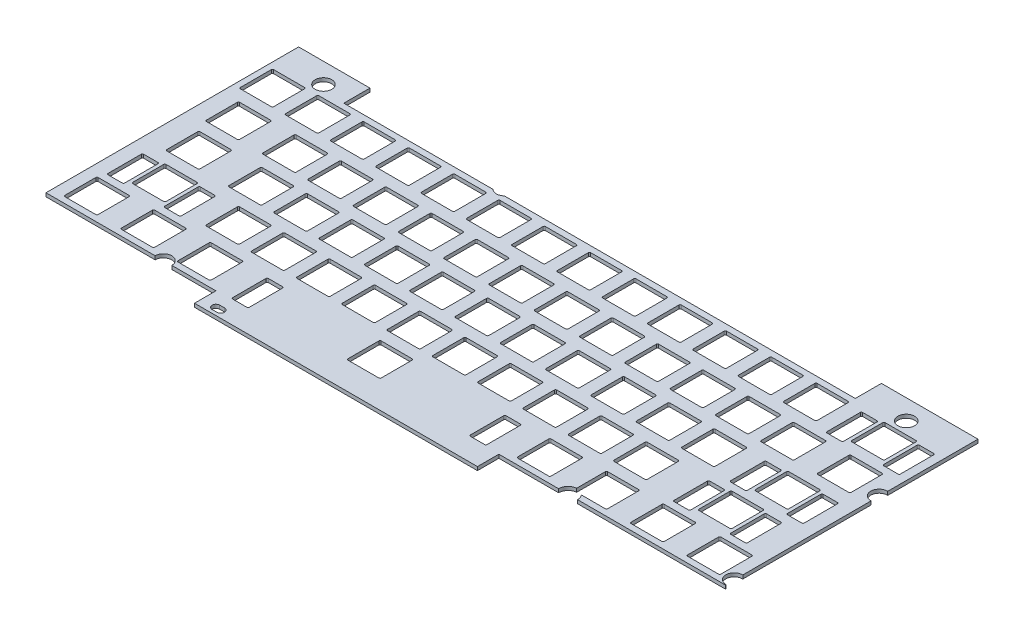
from build123d import *
from build123d.topology import SkipClean

# Parameters (mm, degrees)
SKETCH_3_W          = 285.75
SKETCH_3_H          = 95.25
EXTRUDE_2_DEPTH     = 1.5
CUT_EXTRUDE_1_REACH = 303.211
SKETCH_4_R          = 3.5
SKETCH_4_R_2        = 4
SKETCH_5_W          = 119
SKETCH_5_H          = 9
EXTRUDE_3_DEPTH     = 1.5
CUT_EXTRUDE_2_DEPTH = 1.5


with BuildPart() as part:
    # 草图3 → 凸台-拉伸2 (new body)
    with BuildSketch(Plane(origin=(0, 0, 0), x_dir=(1, 0, 0), z_dir=(0, 1, 0))):
        with Locations((142.875, -47.625)):
            Rectangle(SKETCH_3_W, SKETCH_3_H)
        with BuildLine():
            Line((3.025, -2.525), (16.025, -2.525))
            ThreePointArc((16.025, -2.525), (16.378553391, -2.671446609), (16.525, -3.025))
            Line((16.525, -3.025), (16.525, -16.025))
            ThreePointArc((16.525, -16.025), (16.378553391, -16.378553391), (16.025, -16.525))
            Line((16.025, -16.525), (3.025, -16.525))
            ThreePointArc((3.025, -16.525), (2.671446609, -16.378553391), (2.525, -16.025))
            Line((2.525, -16.025), (2.525, -3.025))
            ThreePointArc((2.525, -3.025), (2.671446609, -2.671446609), (3.025, -2.525))
        make_face(mode=Mode.SUBTRACT)
        with BuildLine():
            Line((22.075, -2.525), (35.075, -2.525))
            ThreePointArc((35.075, -2.525), (35.428553391, -2.671446609), (35.575, -3.025))
            Line((35.575, -3.025), (35.575, -16.025))
            ThreePointArc((35.575, -16.025), (35.428553391, -16.378553391), (35.075, -16.525))
            Line((35.075, -16.525), (22.075, -16.525))
            ThreePointArc((22.075, -16.525), (21.721446609, -16.378553391), (21.575, -16.025))
            Line((21.575, -16.025), (21.575, -3.025))
            ThreePointArc((21.575, -3.025), (21.721446609, -2.671446609), (22.075, -2.525))
        make_face(mode=Mode.SUBTRACT)
        with BuildLine():
            Line((41.125, -2.525), (54.125, -2.525))
            ThreePointArc((54.125, -2.525), (54.478553391, -2.671446609), (54.625, -3.025))
            Line((54.625, -3.025), (54.625, -16.025))
            ThreePointArc((54.625, -16.025), (54.478553391, -16.378553391), (54.125, -16.525))
            Line((54.125, -16.525), (41.125, -16.525))
            ThreePointArc((41.125, -16.525), (40.771446609, -16.378553391), (40.625, -16.025))
            Line((40.625, -16.025), (40.625, -3.025))
            ThreePointArc((40.625, -3.025), (40.771446609, -2.671446609), (41.125, -2.525))
        make_face(mode=Mode.SUBTRACT)
        with BuildLine():
            Line((60.175, -2.525), (73.175, -2.525))
            ThreePointArc((73.175, -2.525), (73.528553391, -2.671446609), (73.675, -3.025))
            Line((73.675, -3.025), (73.675, -16.025))
            ThreePointArc((73.675, -16.025), (73.528553391, -16.378553391), (73.175, -16.525))
            Line((73.175, -16.525), (60.175, -16.525))
            ThreePointArc((60.175, -16.525), (59.821446609, -16.378553391), (59.675, -16.025))
            Line((59.675, -16.025), (59.675, -3.025))
            ThreePointArc((59.675, -3.025), (59.821446609, -2.671446609), (60.175, -2.525))
        make_face(mode=Mode.SUBTRACT)
        with BuildLine():
            Line((79.225, -2.525), (92.225, -2.525))
            ThreePointArc((92.225, -2.525), (92.578553391, -2.671446609), (92.725, -3.025))
            Line((92.725, -3.025), (92.725, -16.025))
            ThreePointArc((92.725, -16.025), (92.578553391, -16.378553391), (92.225, -16.525))
            Line((92.225, -16.525), (79.225, -16.525))
            ThreePointArc((79.225, -16.525), (78.871446609, -16.378553391), (78.725, -16.025))
            Line((78.725, -16.025), (78.725, -3.025))
            ThreePointArc((78.725, -3.025), (78.871446609, -2.671446609), (79.225, -2.525))
        make_face(mode=Mode.SUBTRACT)
        with BuildLine():
            Line((98.275, -2.525), (111.275, -2.525))
            ThreePointArc((111.275, -2.525), (111.628553391, -2.671446609), (111.775, -3.025))
            Line((111.775, -3.025), (111.775, -16.025))
            ThreePointArc((111.775, -16.025), (111.628553391, -16.378553391), (111.275, -16.525))
            Line((111.275, -16.525), (98.275, -16.525))
            ThreePointArc((98.275, -16.525), (97.921446609, -16.378553391), (97.775, -16.025))
            Line((97.775, -16.025), (97.775, -3.025))
            ThreePointArc((97.775, -3.025), (97.921446609, -2.671446609), (98.275, -2.525))
        make_face(mode=Mode.SUBTRACT)
        with BuildLine():
            Line((117.325, -2.525), (130.325, -2.525))
            ThreePointArc((130.325, -2.525), (130.678553391, -2.671446609), (130.825, -3.025))
            Line((130.825, -3.025), (130.825, -16.025))
            ThreePointArc((130.825, -16.025), (130.678553391, -16.378553391), (130.325, -16.525))
            Line((130.325, -16.525), (117.325, -16.525))
            ThreePointArc((117.325, -16.525), (116.971446609, -16.378553391), (116.825, -16.025))
            Line((116.825, -16.025), (116.825, -3.025))
            ThreePointArc((116.825, -3.025), (116.971446609, -2.671446609), (117.325, -2.525))
        make_face(mode=Mode.SUBTRACT)
        with BuildLine():
            Line((136.375, -2.525), (149.375, -2.525))
            ThreePointArc((149.375, -2.525), (149.728553391, -2.671446609), (149.875, -3.025))
            Line((149.875, -3.025), (149.875, -16.025))
            ThreePointArc((149.875, -16.025), (149.728553391, -16.378553391), (149.375, -16.525))
            Line((149.375, -16.525), (136.375, -16.525))
            ThreePointArc((136.375, -16.525), (136.021446609, -16.378553391), (135.875, -16.025))
            Line((135.875, -16.025), (135.875, -3.025))
            ThreePointArc((135.875, -3.025), (136.021446609, -2.671446609), (136.375, -2.525))
        make_face(mode=Mode.SUBTRACT)
        with BuildLine():
            Line((155.425, -2.525), (168.425, -2.525))
            ThreePointArc((168.425, -2.525), (168.778553391, -2.671446609), (168.925, -3.025))
            Line((168.925, -3.025), (168.925, -16.025))
            ThreePointArc((168.925, -16.025), (168.778553391, -16.378553391), (168.425, -16.525))
            Line((168.425, -16.525), (155.425, -16.525))
            ThreePointArc((155.425, -16.525), (155.071446609, -16.378553391), (154.925, -16.025))
            Line((154.925, -16.025), (154.925, -3.025))
            ThreePointArc((154.925, -3.025), (155.071446609, -2.671446609), (155.425, -2.525))
        make_face(mode=Mode.SUBTRACT)
        with BuildLine():
            Line((174.475, -2.525), (187.475, -2.525))
            ThreePointArc((187.475, -2.525), (187.828553391, -2.671446609), (187.975, -3.025))
            Line((187.975, -3.025), (187.975, -16.025))
            ThreePointArc((187.975, -16.025), (187.828553391, -16.378553391), (187.475, -16.525))
            Line((187.475, -16.525), (174.475, -16.525))
            ThreePointArc((174.475, -16.525), (174.121446609, -16.378553391), (173.975, -16.025))
            Line((173.975, -16.025), (173.975, -3.025))
            ThreePointArc((173.975, -3.025), (174.121446609, -2.671446609), (174.475, -2.525))
        make_face(mode=Mode.SUBTRACT)
        with BuildLine():
            Line((193.525, -2.525), (206.525, -2.525))
            ThreePointArc((206.525, -2.525), (206.878553391, -2.671446609), (207.025, -3.025))
            Line((207.025, -3.025), (207.025, -16.025))
            ThreePointArc((207.025, -16.025), (206.878553391, -16.378553391), (206.525, -16.525))
            Line((206.525, -16.525), (193.525, -16.525))
            ThreePointArc((193.525, -16.525), (193.171446609, -16.378553391), (193.025, -16.025))
            Line((193.025, -16.025), (193.025, -3.025))
            ThreePointArc((193.025, -3.025), (193.171446609, -2.671446609), (193.525, -2.525))
        make_face(mode=Mode.SUBTRACT)
        with BuildLine():
            Line((212.575, -2.525), (225.575, -2.525))
            ThreePointArc((225.575, -2.525), (225.928553391, -2.671446609), (226.075, -3.025))
            Line((226.075, -3.025), (226.075, -16.025))
            ThreePointArc((226.075, -16.025), (225.928553391, -16.378553391), (225.575, -16.525))
            Line((225.575, -16.525), (212.575, -16.525))
            ThreePointArc((212.575, -16.525), (212.221446609, -16.378553391), (212.075, -16.025))
            Line((212.075, -16.025), (212.075, -3.025))
            ThreePointArc((212.075, -3.025), (212.221446609, -2.671446609), (212.575, -2.525))
        make_face(mode=Mode.SUBTRACT)
        with BuildLine():
            Line((231.625, -2.525), (244.625, -2.525))
            ThreePointArc((244.625, -2.525), (244.978553391, -2.671446609), (245.125, -3.025))
            Line((245.125, -3.025), (245.125, -16.025))
            ThreePointArc((245.125, -16.025), (244.978553391, -16.378553391), (244.625, -16.525))
            Line((244.625, -16.525), (231.625, -16.525))
            ThreePointArc((231.625, -16.525), (231.271446609, -16.378553391), (231.125, -16.025))
            Line((231.125, -16.025), (231.125, -3.025))
            ThreePointArc((231.125, -3.025), (231.271446609, -2.671446609), (231.625, -2.525))
        make_face(mode=Mode.SUBTRACT)
        with BuildLine():
            Line((260.2, -2.525), (273.2, -2.525))
            ThreePointArc((273.2, -2.525), (273.553553391, -2.671446609), (273.7, -3.025))
            Line((273.7, -3.025), (273.7, -16.025))
            ThreePointArc((273.7, -16.025), (273.553553391, -16.378553391), (273.2, -16.525))
            Line((273.2, -16.525), (260.2, -16.525))
            ThreePointArc((260.2, -16.525), (259.846446609, -16.378553391), (259.7, -16.025))
            Line((259.7, -16.025), (259.7, -3.025))
            ThreePointArc((259.7, -3.025), (259.846446609, -2.671446609), (260.2, -2.525))
        make_face(mode=Mode.SUBTRACT)
        with BuildLine():
            Line((251.762, -3.525), (257.762, -3.525))
            ThreePointArc((257.762, -3.525), (258.115553391, -3.671446609), (258.262, -4.025))
            Line((258.262, -4.025), (258.262, -18.025))
            ThreePointArc((258.262, -18.025), (258.115553391, -18.378553391), (257.762, -18.525))
            Line((257.762, -18.525), (251.762, -18.525))
            ThreePointArc((251.762, -18.525), (251.408446609, -18.378553391), (251.262, -18.025))
            Line((251.262, -18.025), (251.262, -4.025))
            ThreePointArc((251.262, -4.025), (251.408446609, -3.671446609), (251.762, -3.525))
        make_face(mode=Mode.SUBTRACT)
        with BuildLine():
            Line((275.638, -3.525), (281.638, -3.525))
            ThreePointArc((281.638, -3.525), (281.991553391, -3.671446609), (282.138, -4.025))
            Line((282.138, -4.025), (282.138, -18.025))
            ThreePointArc((282.138, -18.025), (281.991553391, -18.378553391), (281.638, -18.525))
            Line((281.638, -18.525), (275.638, -18.525))
            ThreePointArc((275.638, -18.525), (275.284446609, -18.378553391), (275.138, -18.025))
            Line((275.138, -18.025), (275.138, -4.025))
            ThreePointArc((275.138, -4.025), (275.284446609, -3.671446609), (275.638, -3.525))
        make_face(mode=Mode.SUBTRACT)
        with BuildLine():
            Line((7.7875, -21.575), (20.7875, -21.575))
            ThreePointArc((20.7875, -21.575), (21.141053391, -21.721446609), (21.2875, -22.075))
            Line((21.2875, -22.075), (21.2875, -35.075))
            ThreePointArc((21.2875, -35.075), (21.141053391, -35.428553391), (20.7875, -35.575))
            Line((20.7875, -35.575), (7.7875, -35.575))
            ThreePointArc((7.7875, -35.575), (7.433946609, -35.428553391), (7.2875, -35.075))
            Line((7.2875, -35.075), (7.2875, -22.075))
            ThreePointArc((7.2875, -22.075), (7.433946609, -21.721446609), (7.7875, -21.575))
        make_face(mode=Mode.SUBTRACT)
        with BuildLine():
            Line((31.6, -21.575), (44.6, -21.575))
            ThreePointArc((44.6, -21.575), (44.953553391, -21.721446609), (45.1, -22.075))
            Line((45.1, -22.075), (45.1, -35.075))
            ThreePointArc((45.1, -35.075), (44.953553391, -35.428553391), (44.6, -35.575))
            Line((44.6, -35.575), (31.6, -35.575))
            ThreePointArc((31.6, -35.575), (31.246446609, -35.428553391), (31.1, -35.075))
            Line((31.1, -35.075), (31.1, -22.075))
            ThreePointArc((31.1, -22.075), (31.246446609, -21.721446609), (31.6, -21.575))
        make_face(mode=Mode.SUBTRACT)
        with BuildLine():
            Line((50.65, -21.575), (63.65, -21.575))
            ThreePointArc((63.65, -21.575), (64.003553391, -21.721446609), (64.15, -22.075))
            Line((64.15, -22.075), (64.15, -35.075))
            ThreePointArc((64.15, -35.075), (64.003553391, -35.428553391), (63.65, -35.575))
            Line((63.65, -35.575), (50.65, -35.575))
            ThreePointArc((50.65, -35.575), (50.296446609, -35.428553391), (50.15, -35.075))
            Line((50.15, -35.075), (50.15, -22.075))
            ThreePointArc((50.15, -22.075), (50.296446609, -21.721446609), (50.65, -21.575))
        make_face(mode=Mode.SUBTRACT)
        with BuildLine():
            Line((69.7, -21.575), (82.7, -21.575))
            ThreePointArc((82.7, -21.575), (83.053553391, -21.721446609), (83.2, -22.075))
            Line((83.2, -22.075), (83.2, -35.075))
            ThreePointArc((83.2, -35.075), (83.053553391, -35.428553391), (82.7, -35.575))
            Line((82.7, -35.575), (69.7, -35.575))
            ThreePointArc((69.7, -35.575), (69.346446609, -35.428553391), (69.2, -35.075))
            Line((69.2, -35.075), (69.2, -22.075))
            ThreePointArc((69.2, -22.075), (69.346446609, -21.721446609), (69.7, -21.575))
        make_face(mode=Mode.SUBTRACT)
        with BuildLine():
            Line((88.75, -21.575), (101.75, -21.575))
            ThreePointArc((101.75, -21.575), (102.103553391, -21.721446609), (102.25, -22.075))
            Line((102.25, -22.075), (102.25, -35.075))
            ThreePointArc((102.25, -35.075), (102.103553391, -35.428553391), (101.75, -35.575))
            Line((101.75, -35.575), (88.75, -35.575))
            ThreePointArc((88.75, -35.575), (88.396446609, -35.428553391), (88.25, -35.075))
            Line((88.25, -35.075), (88.25, -22.075))
            ThreePointArc((88.25, -22.075), (88.396446609, -21.721446609), (88.75, -21.575))
        make_face(mode=Mode.SUBTRACT)
        with BuildLine():
            Line((107.8, -21.575), (120.8, -21.575))
            ThreePointArc((120.8, -21.575), (121.153553391, -21.721446609), (121.3, -22.075))
            Line((121.3, -22.075), (121.3, -35.075))
            ThreePointArc((121.3, -35.075), (121.153553391, -35.428553391), (120.8, -35.575))
            Line((120.8, -35.575), (107.8, -35.575))
            ThreePointArc((107.8, -35.575), (107.446446609, -35.428553391), (107.3, -35.075))
            Line((107.3, -35.075), (107.3, -22.075))
            ThreePointArc((107.3, -22.075), (107.446446609, -21.721446609), (107.8, -21.575))
        make_face(mode=Mode.SUBTRACT)
        with BuildLine():
            Line((126.85, -21.575), (139.85, -21.575))
            ThreePointArc((139.85, -21.575), (140.203553391, -21.721446609), (140.35, -22.075))
            Line((140.35, -22.075), (140.35, -35.075))
            ThreePointArc((140.35, -35.075), (140.203553391, -35.428553391), (139.85, -35.575))
            Line((139.85, -35.575), (126.85, -35.575))
            ThreePointArc((126.85, -35.575), (126.496446609, -35.428553391), (126.35, -35.075))
            Line((126.35, -35.075), (126.35, -22.075))
            ThreePointArc((126.35, -22.075), (126.496446609, -21.721446609), (126.85, -21.575))
        make_face(mode=Mode.SUBTRACT)
        with BuildLine():
            Line((145.9, -21.575), (158.9, -21.575))
            ThreePointArc((158.9, -21.575), (159.253553391, -21.721446609), (159.4, -22.075))
            Line((159.4, -22.075), (159.4, -35.075))
            ThreePointArc((159.4, -35.075), (159.253553391, -35.428553391), (158.9, -35.575))
            Line((158.9, -35.575), (145.9, -35.575))
            ThreePointArc((145.9, -35.575), (145.546446609, -35.428553391), (145.4, -35.075))
            Line((145.4, -35.075), (145.4, -22.075))
            ThreePointArc((145.4, -22.075), (145.546446609, -21.721446609), (145.9, -21.575))
        make_face(mode=Mode.SUBTRACT)
        with BuildLine():
            Line((164.95, -21.575), (177.95, -21.575))
            ThreePointArc((177.95, -21.575), (178.303553391, -21.721446609), (178.45, -22.075))
            Line((178.45, -22.075), (178.45, -35.075))
            ThreePointArc((178.45, -35.075), (178.303553391, -35.428553391), (177.95, -35.575))
            Line((177.95, -35.575), (164.95, -35.575))
            ThreePointArc((164.95, -35.575), (164.596446609, -35.428553391), (164.45, -35.075))
            Line((164.45, -35.075), (164.45, -22.075))
            ThreePointArc((164.45, -22.075), (164.596446609, -21.721446609), (164.95, -21.575))
        make_face(mode=Mode.SUBTRACT)
        with BuildLine():
            Line((184, -21.575), (197, -21.575))
            ThreePointArc((197, -21.575), (197.353553391, -21.721446609), (197.5, -22.075))
            Line((197.5, -22.075), (197.5, -35.075))
            ThreePointArc((197.5, -35.075), (197.353553391, -35.428553391), (197, -35.575))
            Line((197, -35.575), (184, -35.575))
            ThreePointArc((184, -35.575), (183.646446609, -35.428553391), (183.5, -35.075))
            Line((183.5, -35.075), (183.5, -22.075))
            ThreePointArc((183.5, -22.075), (183.646446609, -21.721446609), (184, -21.575))
        make_face(mode=Mode.SUBTRACT)
        with BuildLine():
            Line((203.05, -21.575), (216.05, -21.575))
            ThreePointArc((216.05, -21.575), (216.403553391, -21.721446609), (216.55, -22.075))
            Line((216.55, -22.075), (216.55, -35.075))
            ThreePointArc((216.55, -35.075), (216.403553391, -35.428553391), (216.05, -35.575))
            Line((216.05, -35.575), (203.05, -35.575))
            ThreePointArc((203.05, -35.575), (202.696446609, -35.428553391), (202.55, -35.075))
            Line((202.55, -35.075), (202.55, -22.075))
            ThreePointArc((202.55, -22.075), (202.696446609, -21.721446609), (203.05, -21.575))
        make_face(mode=Mode.SUBTRACT)
        with BuildLine():
            Line((222.1, -21.575), (235.1, -21.575))
            ThreePointArc((235.1, -21.575), (235.453553391, -21.721446609), (235.6, -22.075))
            Line((235.6, -22.075), (235.6, -35.075))
            ThreePointArc((235.6, -35.075), (235.453553391, -35.428553391), (235.1, -35.575))
            Line((235.1, -35.575), (222.1, -35.575))
            ThreePointArc((222.1, -35.575), (221.746446609, -35.428553391), (221.6, -35.075))
            Line((221.6, -35.075), (221.6, -22.075))
            ThreePointArc((221.6, -22.075), (221.746446609, -21.721446609), (222.1, -21.575))
        make_face(mode=Mode.SUBTRACT)
        with BuildLine():
            Line((241.15, -21.575), (254.15, -21.575))
            ThreePointArc((254.15, -21.575), (254.503553391, -21.721446609), (254.65, -22.075))
            Line((254.65, -22.075), (254.65, -35.075))
            ThreePointArc((254.65, -35.075), (254.503553391, -35.428553391), (254.15, -35.575))
            Line((254.15, -35.575), (241.15, -35.575))
            ThreePointArc((241.15, -35.575), (240.796446609, -35.428553391), (240.65, -35.075))
            Line((240.65, -35.075), (240.65, -22.075))
            ThreePointArc((240.65, -22.075), (240.796446609, -21.721446609), (241.15, -21.575))
        make_face(mode=Mode.SUBTRACT)
        with BuildLine():
            Line((264.9625, -21.575), (277.9625, -21.575))
            ThreePointArc((277.9625, -21.575), (278.316053391, -21.721446609), (278.4625, -22.075))
            Line((278.4625, -22.075), (278.4625, -35.075))
            ThreePointArc((278.4625, -35.075), (278.316053391, -35.428553391), (277.9625, -35.575))
            Line((277.9625, -35.575), (264.9625, -35.575))
            ThreePointArc((264.9625, -35.575), (264.608946609, -35.428553391), (264.4625, -35.075))
            Line((264.4625, -35.075), (264.4625, -22.075))
            ThreePointArc((264.4625, -22.075), (264.608946609, -21.721446609), (264.9625, -21.575))
        make_face(mode=Mode.SUBTRACT)
        with BuildLine():
            Line((10.16875, -40.625), (23.16875, -40.625))
            ThreePointArc((23.16875, -40.625), (23.522303391, -40.771446609), (23.66875, -41.125))
            Line((23.66875, -41.125), (23.66875, -54.125))
            ThreePointArc((23.66875, -54.125), (23.522303391, -54.478553391), (23.16875, -54.625))
            Line((23.16875, -54.625), (10.16875, -54.625))
            ThreePointArc((10.16875, -54.625), (9.815196609, -54.478553391), (9.66875, -54.125))
            Line((9.66875, -54.125), (9.66875, -41.125))
            ThreePointArc((9.66875, -41.125), (9.815196609, -40.771446609), (10.16875, -40.625))
        make_face(mode=Mode.SUBTRACT)
        with BuildLine():
            Line((36.3625, -40.625), (49.3625, -40.625))
            ThreePointArc((49.3625, -40.625), (49.716053391, -40.771446609), (49.8625, -41.125))
            Line((49.8625, -41.125), (49.8625, -54.125))
            ThreePointArc((49.8625, -54.125), (49.716053391, -54.478553391), (49.3625, -54.625))
            Line((49.3625, -54.625), (36.3625, -54.625))
            ThreePointArc((36.3625, -54.625), (36.008946609, -54.478553391), (35.8625, -54.125))
            Line((35.8625, -54.125), (35.8625, -41.125))
            ThreePointArc((35.8625, -41.125), (36.008946609, -40.771446609), (36.3625, -40.625))
        make_face(mode=Mode.SUBTRACT)
        with BuildLine():
            Line((55.4125, -40.625), (68.4125, -40.625))
            ThreePointArc((68.4125, -40.625), (68.766053391, -40.771446609), (68.9125, -41.125))
            Line((68.9125, -41.125), (68.9125, -54.125))
            ThreePointArc((68.9125, -54.125), (68.766053391, -54.478553391), (68.4125, -54.625))
            Line((68.4125, -54.625), (55.4125, -54.625))
            ThreePointArc((55.4125, -54.625), (55.058946609, -54.478553391), (54.9125, -54.125))
            Line((54.9125, -54.125), (54.9125, -41.125))
            ThreePointArc((54.9125, -41.125), (55.058946609, -40.771446609), (55.4125, -40.625))
        make_face(mode=Mode.SUBTRACT)
        with BuildLine():
            Line((74.4625, -40.625), (87.4625, -40.625))
            ThreePointArc((87.4625, -40.625), (87.816053391, -40.771446609), (87.9625, -41.125))
            Line((87.9625, -41.125), (87.9625, -54.125))
            ThreePointArc((87.9625, -54.125), (87.816053391, -54.478553391), (87.4625, -54.625))
            Line((87.4625, -54.625), (74.4625, -54.625))
            ThreePointArc((74.4625, -54.625), (74.108946609, -54.478553391), (73.9625, -54.125))
            Line((73.9625, -54.125), (73.9625, -41.125))
            ThreePointArc((73.9625, -41.125), (74.108946609, -40.771446609), (74.4625, -40.625))
        make_face(mode=Mode.SUBTRACT)
        with BuildLine():
            Line((93.5125, -40.625), (106.5125, -40.625))
            ThreePointArc((106.5125, -40.625), (106.866053391, -40.771446609), (107.0125, -41.125))
            Line((107.0125, -41.125), (107.0125, -54.125))
            ThreePointArc((107.0125, -54.125), (106.866053391, -54.478553391), (106.5125, -54.625))
            Line((106.5125, -54.625), (93.5125, -54.625))
            ThreePointArc((93.5125, -54.625), (93.158946609, -54.478553391), (93.0125, -54.125))
            Line((93.0125, -54.125), (93.0125, -41.125))
            ThreePointArc((93.0125, -41.125), (93.158946609, -40.771446609), (93.5125, -40.625))
        make_face(mode=Mode.SUBTRACT)
        with BuildLine():
            Line((112.5625, -40.625), (125.5625, -40.625))
            ThreePointArc((125.5625, -40.625), (125.916053391, -40.771446609), (126.0625, -41.125))
            Line((126.0625, -41.125), (126.0625, -54.125))
            ThreePointArc((126.0625, -54.125), (125.916053391, -54.478553391), (125.5625, -54.625))
            Line((125.5625, -54.625), (112.5625, -54.625))
            ThreePointArc((112.5625, -54.625), (112.208946609, -54.478553391), (112.0625, -54.125))
            Line((112.0625, -54.125), (112.0625, -41.125))
            ThreePointArc((112.0625, -41.125), (112.208946609, -40.771446609), (112.5625, -40.625))
        make_face(mode=Mode.SUBTRACT)
        with BuildLine():
            Line((131.6125, -40.625), (144.6125, -40.625))
            ThreePointArc((144.6125, -40.625), (144.966053391, -40.771446609), (145.1125, -41.125))
            Line((145.1125, -41.125), (145.1125, -54.125))
            ThreePointArc((145.1125, -54.125), (144.966053391, -54.478553391), (144.6125, -54.625))
            Line((144.6125, -54.625), (131.6125, -54.625))
            ThreePointArc((131.6125, -54.625), (131.258946609, -54.478553391), (131.1125, -54.125))
            Line((131.1125, -54.125), (131.1125, -41.125))
            ThreePointArc((131.1125, -41.125), (131.258946609, -40.771446609), (131.6125, -40.625))
        make_face(mode=Mode.SUBTRACT)
        with BuildLine():
            Line((150.6625, -40.625), (163.6625, -40.625))
            ThreePointArc((163.6625, -40.625), (164.016053391, -40.771446609), (164.1625, -41.125))
            Line((164.1625, -41.125), (164.1625, -54.125))
            ThreePointArc((164.1625, -54.125), (164.016053391, -54.478553391), (163.6625, -54.625))
            Line((163.6625, -54.625), (150.6625, -54.625))
            ThreePointArc((150.6625, -54.625), (150.308946609, -54.478553391), (150.1625, -54.125))
            Line((150.1625, -54.125), (150.1625, -41.125))
            ThreePointArc((150.1625, -41.125), (150.308946609, -40.771446609), (150.6625, -40.625))
        make_face(mode=Mode.SUBTRACT)
        with BuildLine():
            Line((169.7125, -40.625), (182.7125, -40.625))
            ThreePointArc((182.7125, -40.625), (183.066053391, -40.771446609), (183.2125, -41.125))
            Line((183.2125, -41.125), (183.2125, -54.125))
            ThreePointArc((183.2125, -54.125), (183.066053391, -54.478553391), (182.7125, -54.625))
            Line((182.7125, -54.625), (169.7125, -54.625))
            ThreePointArc((169.7125, -54.625), (169.358946609, -54.478553391), (169.2125, -54.125))
            Line((169.2125, -54.125), (169.2125, -41.125))
            ThreePointArc((169.2125, -41.125), (169.358946609, -40.771446609), (169.7125, -40.625))
        make_face(mode=Mode.SUBTRACT)
        with BuildLine():
            Line((188.7625, -40.625), (201.7625, -40.625))
            ThreePointArc((201.7625, -40.625), (202.116053391, -40.771446609), (202.2625, -41.125))
            Line((202.2625, -41.125), (202.2625, -54.125))
            ThreePointArc((202.2625, -54.125), (202.116053391, -54.478553391), (201.7625, -54.625))
            Line((201.7625, -54.625), (188.7625, -54.625))
            ThreePointArc((188.7625, -54.625), (188.408946609, -54.478553391), (188.2625, -54.125))
            Line((188.2625, -54.125), (188.2625, -41.125))
            ThreePointArc((188.2625, -41.125), (188.408946609, -40.771446609), (188.7625, -40.625))
        make_face(mode=Mode.SUBTRACT)
        with BuildLine():
            Line((207.8125, -40.625), (220.8125, -40.625))
            ThreePointArc((220.8125, -40.625), (221.166053391, -40.771446609), (221.3125, -41.125))
            Line((221.3125, -41.125), (221.3125, -54.125))
            ThreePointArc((221.3125, -54.125), (221.166053391, -54.478553391), (220.8125, -54.625))
            Line((220.8125, -54.625), (207.8125, -54.625))
            ThreePointArc((207.8125, -54.625), (207.458946609, -54.478553391), (207.3125, -54.125))
            Line((207.3125, -54.125), (207.3125, -41.125))
            ThreePointArc((207.3125, -41.125), (207.458946609, -40.771446609), (207.8125, -40.625))
        make_face(mode=Mode.SUBTRACT)
        with BuildLine():
            Line((226.8625, -40.625), (239.8625, -40.625))
            ThreePointArc((239.8625, -40.625), (240.216053391, -40.771446609), (240.3625, -41.125))
            Line((240.3625, -41.125), (240.3625, -54.125))
            ThreePointArc((240.3625, -54.125), (240.216053391, -54.478553391), (239.8625, -54.625))
            Line((239.8625, -54.625), (226.8625, -54.625))
            ThreePointArc((226.8625, -54.625), (226.508946609, -54.478553391), (226.3625, -54.125))
            Line((226.3625, -54.125), (226.3625, -41.125))
            ThreePointArc((226.3625, -41.125), (226.508946609, -40.771446609), (226.8625, -40.625))
        make_face(mode=Mode.SUBTRACT)
        with BuildLine():
            Line((257.81875, -40.625), (270.81875, -40.625))
            ThreePointArc((270.81875, -40.625), (271.172303391, -40.771446609), (271.31875, -41.125))
            Line((271.31875, -41.125), (271.31875, -54.125))
            ThreePointArc((271.31875, -54.125), (271.172303391, -54.478553391), (270.81875, -54.625))
            Line((270.81875, -54.625), (257.81875, -54.625))
            ThreePointArc((257.81875, -54.625), (257.465196609, -54.478553391), (257.31875, -54.125))
            Line((257.31875, -54.125), (257.31875, -41.125))
            ThreePointArc((257.31875, -41.125), (257.465196609, -40.771446609), (257.81875, -40.625))
        make_face(mode=Mode.SUBTRACT)
        with BuildLine():
            Line((249.38075, -41.625), (255.38075, -41.625))
            ThreePointArc((255.38075, -41.625), (255.734303391, -41.771446609), (255.88075, -42.125))
            Line((255.88075, -42.125), (255.88075, -56.125))
            ThreePointArc((255.88075, -56.125), (255.734303391, -56.478553391), (255.38075, -56.625))
            Line((255.38075, -56.625), (249.38075, -56.625))
            ThreePointArc((249.38075, -56.625), (249.027196609, -56.478553391), (248.88075, -56.125))
            Line((248.88075, -56.125), (248.88075, -42.125))
            ThreePointArc((248.88075, -42.125), (249.027196609, -41.771446609), (249.38075, -41.625))
        make_face(mode=Mode.SUBTRACT)
        with BuildLine():
            Line((273.25675, -41.625), (279.25675, -41.625))
            ThreePointArc((279.25675, -41.625), (279.610303391, -41.771446609), (279.75675, -42.125))
            Line((279.75675, -42.125), (279.75675, -56.125))
            ThreePointArc((279.75675, -56.125), (279.610303391, -56.478553391), (279.25675, -56.625))
            Line((279.25675, -56.625), (273.25675, -56.625))
            ThreePointArc((273.25675, -56.625), (272.903196609, -56.478553391), (272.75675, -56.125))
            Line((272.75675, -56.125), (272.75675, -42.125))
            ThreePointArc((272.75675, -42.125), (272.903196609, -41.771446609), (273.25675, -41.625))
        make_face(mode=Mode.SUBTRACT)
        with BuildLine():
            Line((14.93125, -59.675), (27.93125, -59.675))
            ThreePointArc((27.93125, -59.675), (28.284803391, -59.821446609), (28.43125, -60.175))
            Line((28.43125, -60.175), (28.43125, -73.175))
            ThreePointArc((28.43125, -73.175), (28.284803391, -73.528553391), (27.93125, -73.675))
            Line((27.93125, -73.675), (14.93125, -73.675))
            ThreePointArc((14.93125, -73.675), (14.577696609, -73.528553391), (14.43125, -73.175))
            Line((14.43125, -73.175), (14.43125, -60.175))
            ThreePointArc((14.43125, -60.175), (14.577696609, -59.821446609), (14.93125, -59.675))
        make_face(mode=Mode.SUBTRACT)
        with BuildLine():
            Line((6.49325, -60.675), (12.49325, -60.675))
            ThreePointArc((12.49325, -60.675), (12.846803391, -60.821446609), (12.99325, -61.175))
            Line((12.99325, -61.175), (12.99325, -75.175))
            ThreePointArc((12.99325, -75.175), (12.846803391, -75.528553391), (12.49325, -75.675))
            Line((12.49325, -75.675), (6.49325, -75.675))
            ThreePointArc((6.49325, -75.675), (6.139696609, -75.528553391), (5.99325, -75.175))
            Line((5.99325, -75.175), (5.99325, -61.175))
            ThreePointArc((5.99325, -61.175), (6.139696609, -60.821446609), (6.49325, -60.675))
        make_face(mode=Mode.SUBTRACT)
        with BuildLine():
            Line((30.36925, -60.675), (36.36925, -60.675))
            ThreePointArc((36.36925, -60.675), (36.722803391, -60.821446609), (36.86925, -61.175))
            Line((36.86925, -61.175), (36.86925, -75.175))
            ThreePointArc((36.86925, -75.175), (36.722803391, -75.528553391), (36.36925, -75.675))
            Line((36.36925, -75.675), (30.36925, -75.675))
            ThreePointArc((30.36925, -75.675), (30.015696609, -75.528553391), (29.86925, -75.175))
            Line((29.86925, -75.175), (29.86925, -61.175))
            ThreePointArc((29.86925, -61.175), (30.015696609, -60.821446609), (30.36925, -60.675))
        make_face(mode=Mode.SUBTRACT)
        with BuildLine():
            Line((45.8875, -59.675), (58.8875, -59.675))
            ThreePointArc((58.8875, -59.675), (59.241053391, -59.821446609), (59.3875, -60.175))
            Line((59.3875, -60.175), (59.3875, -73.175))
            ThreePointArc((59.3875, -73.175), (59.241053391, -73.528553391), (58.8875, -73.675))
            Line((58.8875, -73.675), (45.8875, -73.675))
            ThreePointArc((45.8875, -73.675), (45.533946609, -73.528553391), (45.3875, -73.175))
            Line((45.3875, -73.175), (45.3875, -60.175))
            ThreePointArc((45.3875, -60.175), (45.533946609, -59.821446609), (45.8875, -59.675))
        make_face(mode=Mode.SUBTRACT)
        with BuildLine():
            Line((64.9375, -59.675), (77.9375, -59.675))
            ThreePointArc((77.9375, -59.675), (78.291053391, -59.821446609), (78.4375, -60.175))
            Line((78.4375, -60.175), (78.4375, -73.175))
            ThreePointArc((78.4375, -73.175), (78.291053391, -73.528553391), (77.9375, -73.675))
            Line((77.9375, -73.675), (64.9375, -73.675))
            ThreePointArc((64.9375, -73.675), (64.583946609, -73.528553391), (64.4375, -73.175))
            Line((64.4375, -73.175), (64.4375, -60.175))
            ThreePointArc((64.4375, -60.175), (64.583946609, -59.821446609), (64.9375, -59.675))
        make_face(mode=Mode.SUBTRACT)
        with BuildLine():
            Line((83.9875, -59.675), (96.9875, -59.675))
            ThreePointArc((96.9875, -59.675), (97.341053391, -59.821446609), (97.4875, -60.175))
            Line((97.4875, -60.175), (97.4875, -73.175))
            ThreePointArc((97.4875, -73.175), (97.341053391, -73.528553391), (96.9875, -73.675))
            Line((96.9875, -73.675), (83.9875, -73.675))
            ThreePointArc((83.9875, -73.675), (83.633946609, -73.528553391), (83.4875, -73.175))
            Line((83.4875, -73.175), (83.4875, -60.175))
            ThreePointArc((83.4875, -60.175), (83.633946609, -59.821446609), (83.9875, -59.675))
        make_face(mode=Mode.SUBTRACT)
        with BuildLine():
            Line((103.0375, -59.675), (116.0375, -59.675))
            ThreePointArc((116.0375, -59.675), (116.391053391, -59.821446609), (116.5375, -60.175))
            Line((116.5375, -60.175), (116.5375, -73.175))
            ThreePointArc((116.5375, -73.175), (116.391053391, -73.528553391), (116.0375, -73.675))
            Line((116.0375, -73.675), (103.0375, -73.675))
            ThreePointArc((103.0375, -73.675), (102.683946609, -73.528553391), (102.5375, -73.175))
            Line((102.5375, -73.175), (102.5375, -60.175))
            ThreePointArc((102.5375, -60.175), (102.683946609, -59.821446609), (103.0375, -59.675))
        make_face(mode=Mode.SUBTRACT)
        with BuildLine():
            Line((122.0875, -59.675), (135.0875, -59.675))
            ThreePointArc((135.0875, -59.675), (135.441053391, -59.821446609), (135.5875, -60.175))
            Line((135.5875, -60.175), (135.5875, -73.175))
            ThreePointArc((135.5875, -73.175), (135.441053391, -73.528553391), (135.0875, -73.675))
            Line((135.0875, -73.675), (122.0875, -73.675))
            ThreePointArc((122.0875, -73.675), (121.733946609, -73.528553391), (121.5875, -73.175))
            Line((121.5875, -73.175), (121.5875, -60.175))
            ThreePointArc((121.5875, -60.175), (121.733946609, -59.821446609), (122.0875, -59.675))
        make_face(mode=Mode.SUBTRACT)
        with BuildLine():
            Line((141.1375, -59.675), (154.1375, -59.675))
            ThreePointArc((154.1375, -59.675), (154.491053391, -59.821446609), (154.6375, -60.175))
            Line((154.6375, -60.175), (154.6375, -73.175))
            ThreePointArc((154.6375, -73.175), (154.491053391, -73.528553391), (154.1375, -73.675))
            Line((154.1375, -73.675), (141.1375, -73.675))
            ThreePointArc((141.1375, -73.675), (140.783946609, -73.528553391), (140.6375, -73.175))
            Line((140.6375, -73.175), (140.6375, -60.175))
            ThreePointArc((140.6375, -60.175), (140.783946609, -59.821446609), (141.1375, -59.675))
        make_face(mode=Mode.SUBTRACT)
        with BuildLine():
            Line((160.1875, -59.675), (173.1875, -59.675))
            ThreePointArc((173.1875, -59.675), (173.541053391, -59.821446609), (173.6875, -60.175))
            Line((173.6875, -60.175), (173.6875, -73.175))
            ThreePointArc((173.6875, -73.175), (173.541053391, -73.528553391), (173.1875, -73.675))
            Line((173.1875, -73.675), (160.1875, -73.675))
            ThreePointArc((160.1875, -73.675), (159.833946609, -73.528553391), (159.6875, -73.175))
            Line((159.6875, -73.175), (159.6875, -60.175))
            ThreePointArc((159.6875, -60.175), (159.833946609, -59.821446609), (160.1875, -59.675))
        make_face(mode=Mode.SUBTRACT)
        with BuildLine():
            Line((179.2375, -59.675), (192.2375, -59.675))
            ThreePointArc((192.2375, -59.675), (192.591053391, -59.821446609), (192.7375, -60.175))
            Line((192.7375, -60.175), (192.7375, -73.175))
            ThreePointArc((192.7375, -73.175), (192.591053391, -73.528553391), (192.2375, -73.675))
            Line((192.2375, -73.675), (179.2375, -73.675))
            ThreePointArc((179.2375, -73.675), (178.883946609, -73.528553391), (178.7375, -73.175))
            Line((178.7375, -73.175), (178.7375, -60.175))
            ThreePointArc((178.7375, -60.175), (178.883946609, -59.821446609), (179.2375, -59.675))
        make_face(mode=Mode.SUBTRACT)
        with BuildLine():
            Line((198.2875, -59.675), (211.2875, -59.675))
            ThreePointArc((211.2875, -59.675), (211.641053391, -59.821446609), (211.7875, -60.175))
            Line((211.7875, -60.175), (211.7875, -73.175))
            ThreePointArc((211.7875, -73.175), (211.641053391, -73.528553391), (211.2875, -73.675))
            Line((211.2875, -73.675), (198.2875, -73.675))
            ThreePointArc((198.2875, -73.675), (197.933946609, -73.528553391), (197.7875, -73.175))
            Line((197.7875, -73.175), (197.7875, -60.175))
            ThreePointArc((197.7875, -60.175), (197.933946609, -59.821446609), (198.2875, -59.675))
        make_face(mode=Mode.SUBTRACT)
        with BuildLine():
            Line((217.3375, -59.675), (230.3375, -59.675))
            ThreePointArc((230.3375, -59.675), (230.691053391, -59.821446609), (230.8375, -60.175))
            Line((230.8375, -60.175), (230.8375, -73.175))
            ThreePointArc((230.8375, -73.175), (230.691053391, -73.528553391), (230.3375, -73.675))
            Line((230.3375, -73.675), (217.3375, -73.675))
            ThreePointArc((217.3375, -73.675), (216.983946609, -73.528553391), (216.8375, -73.175))
            Line((216.8375, -73.175), (216.8375, -60.175))
            ThreePointArc((216.8375, -60.175), (216.983946609, -59.821446609), (217.3375, -59.675))
        make_face(mode=Mode.SUBTRACT)
        with BuildLine():
            Line((253.05625, -59.675), (266.05625, -59.675))
            ThreePointArc((266.05625, -59.675), (266.409803391, -59.821446609), (266.55625, -60.175))
            Line((266.55625, -60.175), (266.55625, -73.175))
            ThreePointArc((266.55625, -73.175), (266.409803391, -73.528553391), (266.05625, -73.675))
            Line((266.05625, -73.675), (253.05625, -73.675))
            ThreePointArc((253.05625, -73.675), (252.702696609, -73.528553391), (252.55625, -73.175))
            Line((252.55625, -73.175), (252.55625, -60.175))
            ThreePointArc((252.55625, -60.175), (252.702696609, -59.821446609), (253.05625, -59.675))
        make_face(mode=Mode.SUBTRACT)
        with BuildLine():
            Line((244.61825, -60.675), (250.61825, -60.675))
            ThreePointArc((250.61825, -60.675), (250.971803391, -60.821446609), (251.11825, -61.175))
            Line((251.11825, -61.175), (251.11825, -75.175))
            ThreePointArc((251.11825, -75.175), (250.971803391, -75.528553391), (250.61825, -75.675))
            Line((250.61825, -75.675), (244.61825, -75.675))
            ThreePointArc((244.61825, -75.675), (244.264696609, -75.528553391), (244.11825, -75.175))
            Line((244.11825, -75.175), (244.11825, -61.175))
            ThreePointArc((244.11825, -61.175), (244.264696609, -60.821446609), (244.61825, -60.675))
        make_face(mode=Mode.SUBTRACT)
        with BuildLine():
            Line((268.49425, -60.675), (274.49425, -60.675))
            ThreePointArc((274.49425, -60.675), (274.847803391, -60.821446609), (274.99425, -61.175))
            Line((274.99425, -61.175), (274.99425, -75.175))
            ThreePointArc((274.99425, -75.175), (274.847803391, -75.528553391), (274.49425, -75.675))
            Line((274.49425, -75.675), (268.49425, -75.675))
            ThreePointArc((268.49425, -75.675), (268.140696609, -75.528553391), (267.99425, -75.175))
            Line((267.99425, -75.175), (267.99425, -61.175))
            ThreePointArc((267.99425, -61.175), (268.140696609, -60.821446609), (268.49425, -60.675))
        make_face(mode=Mode.SUBTRACT)
        with BuildLine():
            Line((5.40625, -78.725), (18.40625, -78.725))
            ThreePointArc((18.40625, -78.725), (18.759803391, -78.871446609), (18.90625, -79.225))
            Line((18.90625, -79.225), (18.90625, -92.225))
            ThreePointArc((18.90625, -92.225), (18.759803391, -92.578553391), (18.40625, -92.725))
            Line((18.40625, -92.725), (5.40625, -92.725))
            ThreePointArc((5.40625, -92.725), (5.052696609, -92.578553391), (4.90625, -92.225))
            Line((4.90625, -92.225), (4.90625, -79.225))
            ThreePointArc((4.90625, -79.225), (5.052696609, -78.871446609), (5.40625, -78.725))
        make_face(mode=Mode.SUBTRACT)
        with BuildLine():
            Line((29.21875, -78.725), (42.21875, -78.725))
            ThreePointArc((42.21875, -78.725), (42.572303391, -78.871446609), (42.71875, -79.225))
            Line((42.71875, -79.225), (42.71875, -92.225))
            ThreePointArc((42.71875, -92.225), (42.572303391, -92.578553391), (42.21875, -92.725))
            Line((42.21875, -92.725), (29.21875, -92.725))
            ThreePointArc((29.21875, -92.725), (28.865196609, -92.578553391), (28.71875, -92.225))
            Line((28.71875, -92.225), (28.71875, -79.225))
            ThreePointArc((28.71875, -79.225), (28.865196609, -78.871446609), (29.21875, -78.725))
        make_face(mode=Mode.SUBTRACT)
        with BuildLine():
            Line((53.03125, -78.725), (66.03125, -78.725))
            ThreePointArc((66.03125, -78.725), (66.384803391, -78.871446609), (66.53125, -79.225))
            Line((66.53125, -79.225), (66.53125, -92.225))
            ThreePointArc((66.53125, -92.225), (66.384803391, -92.578553391), (66.03125, -92.725))
            Line((66.03125, -92.725), (53.03125, -92.725))
            ThreePointArc((53.03125, -92.725), (52.677696609, -92.578553391), (52.53125, -92.225))
            Line((52.53125, -92.225), (52.53125, -79.225))
            ThreePointArc((52.53125, -79.225), (52.677696609, -78.871446609), (53.03125, -78.725))
        make_face(mode=Mode.SUBTRACT)
        with BuildLine():
            Line((124.46875, -78.725), (137.46875, -78.725))
            ThreePointArc((137.46875, -78.725), (137.822303391, -78.871446609), (137.96875, -79.225))
            Line((137.96875, -79.225), (137.96875, -92.225))
            ThreePointArc((137.96875, -92.225), (137.822303391, -92.578553391), (137.46875, -92.725))
            Line((137.46875, -92.725), (124.46875, -92.725))
            ThreePointArc((124.46875, -92.725), (124.115196609, -92.578553391), (123.96875, -92.225))
            Line((123.96875, -92.225), (123.96875, -79.225))
            ThreePointArc((123.96875, -79.225), (124.115196609, -78.871446609), (124.46875, -78.725))
        make_face(mode=Mode.SUBTRACT)
        with BuildLine():
            Line((77.96875, -79.725), (83.96875, -79.725))
            ThreePointArc((83.96875, -79.725), (84.322303391, -79.871446609), (84.46875, -80.225))
            Line((84.46875, -80.225), (84.46875, -94.225))
            ThreePointArc((84.46875, -94.225), (84.322303391, -94.578553391), (83.96875, -94.725))
            Line((83.96875, -94.725), (77.96875, -94.725))
            ThreePointArc((77.96875, -94.725), (77.615196609, -94.578553391), (77.46875, -94.225))
            Line((77.46875, -94.225), (77.46875, -80.225))
            ThreePointArc((77.46875, -80.225), (77.615196609, -79.871446609), (77.96875, -79.725))
        make_face(mode=Mode.SUBTRACT)
        with BuildLine():
            Line((177.96875, -79.725), (183.96875, -79.725))
            ThreePointArc((183.96875, -79.725), (184.322303391, -79.871446609), (184.46875, -80.225))
            Line((184.46875, -80.225), (184.46875, -94.225))
            ThreePointArc((184.46875, -94.225), (184.322303391, -94.578553391), (183.96875, -94.725))
            Line((183.96875, -94.725), (177.96875, -94.725))
            ThreePointArc((177.96875, -94.725), (177.615196609, -94.578553391), (177.46875, -94.225))
            Line((177.46875, -94.225), (177.46875, -80.225))
            ThreePointArc((177.46875, -80.225), (177.615196609, -79.871446609), (177.96875, -79.725))
        make_face(mode=Mode.SUBTRACT)
        with BuildLine():
            Line((195.90625, -78.725), (208.90625, -78.725))
            ThreePointArc((208.90625, -78.725), (209.259803391, -78.871446609), (209.40625, -79.225))
            Line((209.40625, -79.225), (209.40625, -92.225))
            ThreePointArc((209.40625, -92.225), (209.259803391, -92.578553391), (208.90625, -92.725))
            Line((208.90625, -92.725), (195.90625, -92.725))
            ThreePointArc((195.90625, -92.725), (195.552696609, -92.578553391), (195.40625, -92.225))
            Line((195.40625, -92.225), (195.40625, -79.225))
            ThreePointArc((195.40625, -79.225), (195.552696609, -78.871446609), (195.90625, -78.725))
        make_face(mode=Mode.SUBTRACT)
        with BuildLine():
            Line((219.71875, -78.725), (232.71875, -78.725))
            ThreePointArc((232.71875, -78.725), (233.072303391, -78.871446609), (233.21875, -79.225))
            Line((233.21875, -79.225), (233.21875, -92.225))
            ThreePointArc((233.21875, -92.225), (233.072303391, -92.578553391), (232.71875, -92.725))
            Line((232.71875, -92.725), (219.71875, -92.725))
            ThreePointArc((219.71875, -92.725), (219.365196609, -92.578553391), (219.21875, -92.225))
            Line((219.21875, -92.225), (219.21875, -79.225))
            ThreePointArc((219.21875, -79.225), (219.365196609, -78.871446609), (219.71875, -78.725))
        make_face(mode=Mode.SUBTRACT)
        with BuildLine():
            Line((243.53125, -78.725), (256.53125, -78.725))
            ThreePointArc((256.53125, -78.725), (256.884803391, -78.871446609), (257.03125, -79.225))
            Line((257.03125, -79.225), (257.03125, -92.225))
            ThreePointArc((257.03125, -92.225), (256.884803391, -92.578553391), (256.53125, -92.725))
            Line((256.53125, -92.725), (243.53125, -92.725))
            ThreePointArc((243.53125, -92.725), (243.177696609, -92.578553391), (243.03125, -92.225))
            Line((243.03125, -92.225), (243.03125, -79.225))
            ThreePointArc((243.03125, -79.225), (243.177696609, -78.871446609), (243.53125, -78.725))
        make_face(mode=Mode.SUBTRACT)
        with BuildLine():
            Line((267.34375, -78.725), (280.34375, -78.725))
            ThreePointArc((280.34375, -78.725), (280.697303391, -78.871446609), (280.84375, -79.225))
            Line((280.84375, -79.225), (280.84375, -92.225))
            ThreePointArc((280.84375, -92.225), (280.697303391, -92.578553391), (280.34375, -92.725))
            Line((280.34375, -92.725), (267.34375, -92.725))
            ThreePointArc((267.34375, -92.725), (266.990196609, -92.578553391), (266.84375, -92.225))
            Line((266.84375, -92.225), (266.84375, -79.225))
            ThreePointArc((266.84375, -79.225), (266.990196609, -78.871446609), (267.34375, -78.725))
        make_face(mode=Mode.SUBTRACT)
    extrude(amount=EXTRUDE_2_DEPTH)

    # 草图4 → 切除-拉伸1 (cut, up to next)
    with BuildSketch(Plane(origin=(0, 1.5, 0), x_dir=(1, 0, 0), z_dir=(0, 1, 0)), mode=Mode.PRIVATE) as cut_extrude_1_sk1:
        with Locations((49.4029886, -95.2499886)):
            Circle(SKETCH_4_R)
    cut_extrude_1_tool1 = extrude(cut_extrude_1_sk1.sketch, amount=-CUT_EXTRUDE_1_REACH, mode=Mode.PRIVATE) & part.part
    # 草图4 → 切除-拉伸1 (cut, up to next)
    with BuildSketch(Plane(origin=(0, 1.5, 0), x_dir=(1, 0, 0), z_dir=(0, 1, 0)), mode=Mode.PRIVATE) as cut_extrude_1_sk2:
        with Locations((219.5829886, -95.2499886)):
            Circle(SKETCH_4_R_2)
    cut_extrude_1_tool2 = extrude(cut_extrude_1_sk2.sketch, amount=-CUT_EXTRUDE_1_REACH, mode=Mode.PRIVATE) & part.part
    # 草图4 → 切除-拉伸1 (cut, up to next)
    with BuildSketch(Plane(origin=(0, 1.5, 0), x_dir=(1, 0, 0), z_dir=(0, 1, 0)), mode=Mode.PRIVATE) as cut_extrude_1_sk3:
        with Locations((285.6229886, -91.4399886)):
            Circle(SKETCH_4_R)
    cut_extrude_1_tool3 = extrude(cut_extrude_1_sk3.sketch, amount=-CUT_EXTRUDE_1_REACH, mode=Mode.PRIVATE) & part.part
    # 草图4 → 切除-拉伸1 (cut, up to next)
    with BuildSketch(Plane(origin=(0, 1.5, 0), x_dir=(1, 0, 0), z_dir=(0, 1, 0)), mode=Mode.PRIVATE) as cut_extrude_1_sk4:
        with Locations((18.9229886, 2.5400114)):
            Circle(SKETCH_4_R)
    cut_extrude_1_tool4 = extrude(cut_extrude_1_sk4.sketch, amount=-CUT_EXTRUDE_1_REACH, mode=Mode.PRIVATE) & part.part
    # 草图4 → 切除-拉伸1 (cut, up to next)
    with BuildSketch(Plane(origin=(0, 1.5, 0), x_dir=(1, 0, 0), z_dir=(0, 1, 0)), mode=Mode.PRIVATE) as cut_extrude_1_sk5:
        with Locations((285.6229886, -30.4799886)):
            Circle(SKETCH_4_R)
    cut_extrude_1_tool5 = extrude(cut_extrude_1_sk5.sketch, amount=-CUT_EXTRUDE_1_REACH, mode=Mode.PRIVATE) & part.part
    # 草图4 → 切除-拉伸1 (cut, up to next)
    with BuildSketch(Plane(origin=(0, 1.5, 0), x_dir=(1, 0, 0), z_dir=(0, 1, 0)), mode=Mode.PRIVATE) as cut_extrude_1_sk6:
        with Locations((264.0329886, 2.5400114)):
            Circle(SKETCH_4_R)
    cut_extrude_1_tool6 = extrude(cut_extrude_1_sk6.sketch, amount=-CUT_EXTRUDE_1_REACH, mode=Mode.PRIVATE) & part.part
    # 草图4 → 切除-拉伸1 (cut, up to next)
    with BuildSketch(Plane(origin=(0, 1.5, 0), x_dir=(1, 0, 0), z_dir=(0, 1, 0)), mode=Mode.PRIVATE) as cut_extrude_1_sk7:
        with Locations((95.1229886, 2.5400114)):
            Circle(SKETCH_4_R)
    cut_extrude_1_tool7 = extrude(cut_extrude_1_sk7.sketch, amount=-CUT_EXTRUDE_1_REACH, mode=Mode.PRIVATE) & part.part
    add(cut_extrude_1_tool1.solids().sort_by_distance((49.402989, 1.5, 95.249989))[0], mode=Mode.SUBTRACT)
    add(cut_extrude_1_tool2.solids().sort_by_distance((219.582989, 1.5, 95.249989))[0], mode=Mode.SUBTRACT)
    add(cut_extrude_1_tool3.solids().sort_by_distance((285.622989, 1.5, 91.439989))[0], mode=Mode.SUBTRACT)
    add(cut_extrude_1_tool4.solids().sort_by_distance((18.922989, 1.5, -2.540011))[0], mode=Mode.SUBTRACT)
    add(cut_extrude_1_tool5.solids().sort_by_distance((285.622989, 1.5, 30.479989))[0], mode=Mode.SUBTRACT)
    add(cut_extrude_1_tool6.solids().sort_by_distance((264.032989, 1.5, -2.540011))[0], mode=Mode.SUBTRACT)
    add(cut_extrude_1_tool7.solids().sort_by_distance((95.122989, 1.5, -2.540011))[0], mode=Mode.SUBTRACT)

    # 草图5 → 凸台-拉伸3 (add)
    with SkipClean():  # the faces are left unmerged after this step: merging them gives an invalid solid
        with BuildSketch(Plane(origin=(0, 1.5, 0), x_dir=(1, 0, 0), z_dir=(0, 1, 0))):
            with Locations((130.96875, -99.75)):
                Rectangle(SKETCH_5_W, SKETCH_5_H)
            with BuildLine():
                Line((21.330963286, 0), (30, 0))
                Line((30, 0), (30, 11))
                Line((30, 11), (0, 11))
                Line((0, 11), (0, 0))
                Line((0, 0), (16.515013914, 0))
                ThreePointArc((16.515013914, 0), (18.9229886, 6.0400114), (21.330963286, 0))
            make_face()
            with BuildLine():
                Line((285.75, 0), (266.440963286, 0))
                ThreePointArc((266.440963286, 0), (264.0329886, 6.0400114), (261.625013914, 0))
                Line((261.625013914, 0), (245.125, 0))
                Line((245.125, 0), (245.125, 11))
                Line((245.125, 11), (285.75, 11))
                Line((285.75, 11), (285.75, 0))
            make_face()
        extrude(amount=-EXTRUDE_3_DEPTH)

    # 草图6 → 切除-拉伸2 (cut)
    with SkipClean():  # the faces are left unmerged after this step: merging them gives an invalid solid
        with BuildSketch(Plane(origin=(0, 1.5, 0), x_dir=(1, 0, 0), z_dir=(0, 1, 0))):
            with BuildLine():
                Line((77.46875, -99.65), (79.46875, -99.65))
                ThreePointArc((79.46875, -99.65), (81.06875, -101.25), (79.46875, -102.85))
                Line((79.46875, -102.85), (77.46875, -102.85))
                ThreePointArc((77.46875, -102.85), (75.86875, -101.25), (77.46875, -99.65))
            make_face()
        extrude(amount=-CUT_EXTRUDE_2_DEPTH, mode=Mode.SUBTRACT)


solid = part.part
